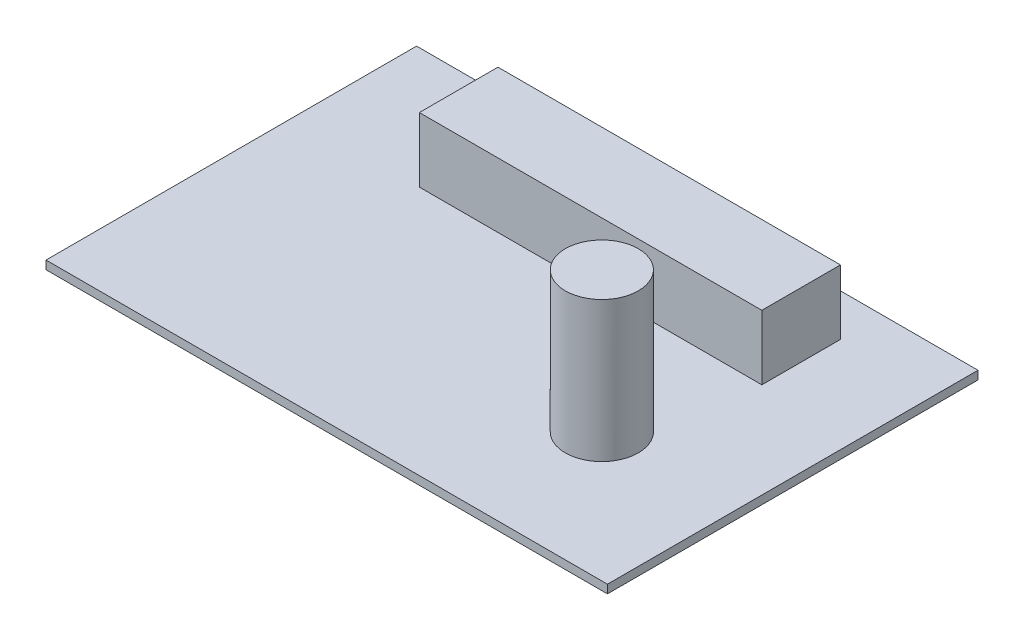
from build123d import *

# Parameters (mm, degrees)
SKIZZE1_W                       = 100
SKIZZE1_H                       = 66
AUFSATZ_LINEAR_AUSTRAGEN1_DEPTH = 1.5
SKIZZE2_W                       = 61
SKIZZE2_H                       = 14
AUFSATZ_LINEAR_AUSTRAGEN2_DEPTH = 11.5
SKIZZE3_R                       = 6.5
AUFSATZ_LINEAR_AUSTRAGEN3_DEPTH = 25


with BuildPart() as part:
    # Skizze1 → Aufsatz-Linear austragen1 (new body)
    with BuildSketch(Plane(origin=(0, 0, 0), x_dir=(1, 0, 0), z_dir=(0, 1, 0))):
        Rectangle(SKIZZE1_W, SKIZZE1_H)
    extrude(amount=AUFSATZ_LINEAR_AUSTRAGEN1_DEPTH)

    # Skizze2 → Aufsatz-Linear austragen2 (add)
    with BuildSketch(Plane(origin=(0, 1.5, 0), x_dir=(1, 0, 0), z_dir=(0, 1, 0))):
        with Locations((2.5, 18.5)):
            Rectangle(SKIZZE2_W, SKIZZE2_H)
    extrude(amount=AUFSATZ_LINEAR_AUSTRAGEN2_DEPTH)

    # Skizze3 → Aufsatz-Linear austragen3 (add)
    with BuildSketch(Plane(origin=(0, 1.5, 0), x_dir=(1, 0, 0), z_dir=(0, 1, 0))):
        with Locations((26, -10)):
            Circle(SKIZZE3_R)
    extrude(amount=AUFSATZ_LINEAR_AUSTRAGEN3_DEPTH)


solid = part.part
